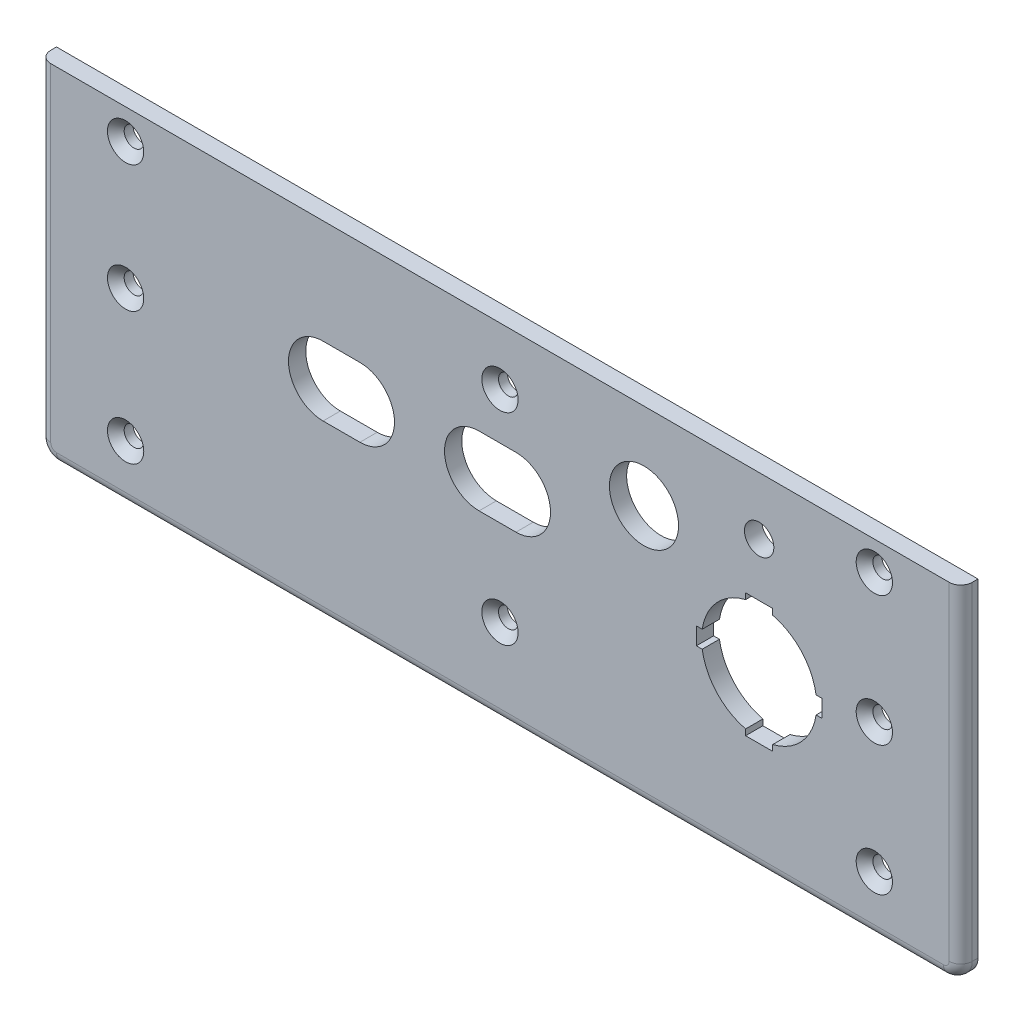
from build123d import *

# Parameters (mm, degrees)
SKETCH11_W                                     = 160
SKETCH11_H                                     = 60
SKETCH11_R                                     = 2.55
SKETCH11_R_2                                   = 6
BOSS_EXTRUDE1_DEPTH                            = 3
FILLET1_R                                      = 2
FILLET3_R                                      = 3
CSK_FOR_M3_FLAT_HEAD_MACHINE_SCREW1_AT_2_COUNT = 2
CSK_FOR_M3_FLAT_HEAD_MACHINE_SCREW1_AT_2_PITCH = 22.042551394
CSK_FOR_M3_FLAT_HEAD_MACHINE_SCREW1_AT_3_COUNT = 2
CSK_FOR_M3_FLAT_HEAD_MACHINE_SCREW1_AT_3_PITCH = 45
CSK_FOR_M3_FLAT_HEAD_MACHINE_SCREW1_AT_4_COUNT = 2
CSK_FOR_M3_FLAT_HEAD_MACHINE_SCREW1_AT_4_PITCH = 137.493516675
CSK_FOR_M3_FLAT_HEAD_MACHINE_SCREW1_AT_5_COUNT = 2
CSK_FOR_M3_FLAT_HEAD_MACHINE_SCREW1_AT_5_PITCH = 131.893933603
CSK_FOR_M3_FLAT_HEAD_MACHINE_SCREW1_AT_6_COUNT = 2
CSK_FOR_M3_FLAT_HEAD_MACHINE_SCREW1_AT_6_PITCH = 130.000201211
CSK_FOR_M3_FLAT_HEAD_MACHINE_SCREW1_AT_7_COUNT = 2
CSK_FOR_M3_FLAT_HEAD_MACHINE_SCREW1_AT_7_PITCH = 65.174880681
CSK_FOR_M3_FLAT_HEAD_MACHINE_SCREW1_AT_8_COUNT = 2
CSK_FOR_M3_FLAT_HEAD_MACHINE_SCREW1_AT_8_PITCH = 76.202062771


with BuildPart() as part:
    # Sketch11 → Boss-Extrude1 (new body)
    with BuildSketch(Plane.XY):
        with Locations((-80, 30)):
            Rectangle(SKETCH11_W, SKETCH11_H)
        with Locations((-35, 50)):
            Circle(SKETCH11_R, mode=Mode.SUBTRACT)
        with Locations((-55, 45)):
            Circle(SKETCH11_R_2, mode=Mode.SUBTRACT)
        with BuildLine():
            Line((-44.886859967, 31.5), (-45.897247359, 31.5))
            Line((-45.897247359, 31.5), (-45.897247359, 28.5))
            Line((-45.897247359, 28.5), (-44.886859967, 28.5))
            ThreePointArc((-44.886859967, 28.5), (-42.370691635, 23.241826814), (-37.35, 20.280046296))
            Line((-37.35, 20.280046296), (-37.35, 19.253954216))
            Line((-37.35, 19.253954216), (-32.65, 19.253954216))
            Line((-32.65, 19.253954216), (-32.65, 20.280046296))
            ThreePointArc((-32.65, 20.280046296), (-27.629308365, 23.241826814), (-25.113140033, 28.5))
            Line((-25.113140033, 28.5), (-24.102752641, 28.5))
            Line((-24.102752641, 28.5), (-24.102752641, 31.5))
            Line((-24.102752641, 31.5), (-25.113140033, 31.5))
            ThreePointArc((-25.113140033, 31.5), (-27.629308365, 36.758173186), (-32.65, 39.719953704))
            Line((-32.65, 39.719953704), (-32.65, 40.746045784))
            Line((-32.65, 40.746045784), (-37.35, 40.746045784))
            Line((-37.35, 40.746045784), (-37.35, 39.719953704))
            ThreePointArc((-37.35, 39.719953704), (-42.370691635, 36.758173186), (-44.886859967, 31.5))
        make_face(mode=Mode.SUBTRACT)
        with BuildLine():
            Line((-83.627304882, 41.930328357), (-77.227304882, 41.930328357))
            ThreePointArc((-77.227304882, 41.930328357), (-71.227304882, 35.930328357), (-77.227304882, 29.930328357))
            Line((-77.227304882, 29.930328357), (-83.627304882, 29.930328357))
            ThreePointArc((-83.627304882, 29.930328357), (-89.627304882, 35.930328357), (-83.627304882, 41.930328357))
        make_face(mode=Mode.SUBTRACT)
        with BuildLine():
            Line((-110.715747539, 41.9), (-104.315747539, 41.9))
            ThreePointArc((-104.315747539, 41.9), (-98.315747539, 35.9), (-104.315747539, 29.9))
            Line((-104.315747539, 29.9), (-110.715747539, 29.9))
            ThreePointArc((-110.715747539, 29.9), (-116.715747539, 35.9), (-110.715747539, 41.9))
        make_face(mode=Mode.SUBTRACT)
    extrude(amount=BOSS_EXTRUDE1_DEPTH)

    # Fillet1
    fillet1_edges = [part.edges().sort_by_distance(p)[0] for p in [
        (-160, 30, 3),
        (-80, 0, 3),
        (0, 30, 3),
    ]]
    fillet(fillet1_edges, radius=FILLET1_R)

    # Fillet3
    # the kernel refuses this fillet: 3 mm, written as the material it takes off along each edge
    with BuildSketch(Plane(origin=(-3, 3, 3), x_dir=(0, -1, 0), z_dir=(-1, 0, 0))) as fillet3_piece_1:
        with BuildLine():
            CenterArc((1, -2), 2, 0, 90)
            Line((3, -2), (3, 0))
            Line((3, 0), (1, 0))
        make_face()
    revolve(axis=Axis((-3, 3, 3), (0, 0, 1)), revolution_arc=90, mode=Mode.SUBTRACT)
    with BuildSketch(Plane(origin=(-157, 3, 3), x_dir=(-1, 0, 0), z_dir=(0, 1, 0))) as fillet3_piece_2:
        with BuildLine():
            CenterArc((1, -2), 2, 0, 90)
            Line((3, -2), (3, 0))
            Line((3, 0), (1, 0))
        make_face()
    revolve(axis=Axis((-157, 3, 3), (0, 0, 1)), revolution_arc=90, mode=Mode.SUBTRACT)
    with BuildSketch(Plane(origin=(0, 0, -7.5), x_dir=(-1, 0, 0), z_dir=(0, 0, 1))) as fillet3_piece_3:
        with BuildLine():
            CenterArc((FILLET3_R, -FILLET3_R), FILLET3_R, 90, 90)
            Line((0, -FILLET3_R), (0, 0))
            Line((0, 0), (FILLET3_R, 0))
        make_face()
    extrude(amount=10.5, mode=Mode.SUBTRACT)
    with BuildSketch(Plane(origin=(-160, 0, -7.5), x_dir=(1, 0, 0), z_dir=(0, 0, 1))) as fillet3_piece_4:
        with BuildLine():
            CenterArc((FILLET3_R, FILLET3_R), FILLET3_R, 180, 90)
            Line((0, FILLET3_R), (0, 0))
            Line((0, 0), (FILLET3_R, 0))
        make_face()
    extrude(amount=10.5, mode=Mode.SUBTRACT)

    # Sketch13 → CSK for M3 Flat Head Machine Screw1 (revolve, cut)
    with BuildSketch(Plane(origin=(-145, 54.771275697, 3), x_dir=(0, -1, 0), z_dir=(1, 0, 0))):
        Polygon((0, 0), (0, 3), (1.7, 3), (1.7, 1.45), (3.15, 0), align=None)
    csk_for_m3_flat_head_machine_screw1 = revolve(axis=Axis((-145, 54.771275697, 9.35), (0, 0, -1)), mode=Mode.SUBTRACT)

    # CSK for M3 Flat Head Machine Screw1 at 2: CSK for M3 Flat Head Machine Screw1 ×2
    with Locations(*[(0, -i * CSK_FOR_M3_FLAT_HEAD_MACHINE_SCREW1_AT_2_PITCH, 0) for i in range(1, CSK_FOR_M3_FLAT_HEAD_MACHINE_SCREW1_AT_2_COUNT)]):
        add(csk_for_m3_flat_head_machine_screw1, mode=Mode.SUBTRACT)

    # CSK for M3 Flat Head Machine Screw1 at 3: CSK for M3 Flat Head Machine Screw1 ×2
    with Locations(*[(0, -i * CSK_FOR_M3_FLAT_HEAD_MACHINE_SCREW1_AT_3_PITCH, 0) for i in range(1, CSK_FOR_M3_FLAT_HEAD_MACHINE_SCREW1_AT_3_COUNT)]):
        add(csk_for_m3_flat_head_machine_screw1, mode=Mode.SUBTRACT)

    # CSK for M3 Flat Head Machine Screw1 at 4: CSK for M3 Flat Head Machine Screw1 ×2
    with Locations(*[Vector(0.9454991271168814, -0.32562463147190707, 0) * (i * CSK_FOR_M3_FLAT_HEAD_MACHINE_SCREW1_AT_4_PITCH) for i in range(1, CSK_FOR_M3_FLAT_HEAD_MACHINE_SCREW1_AT_4_COUNT)]):
        add(csk_for_m3_flat_head_machine_screw1, mode=Mode.SUBTRACT)

    # CSK for M3 Flat Head Machine Screw1 at 5: CSK for M3 Flat Head Machine Screw1 ×2
    with Locations(*[Vector(0.9856404798092461, -0.16885746818367017, 0) * (i * CSK_FOR_M3_FLAT_HEAD_MACHINE_SCREW1_AT_5_PITCH) for i in range(1, CSK_FOR_M3_FLAT_HEAD_MACHINE_SCREW1_AT_5_COUNT)]):
        add(csk_for_m3_flat_head_machine_screw1, mode=Mode.SUBTRACT)

    # CSK for M3 Flat Head Machine Screw1 at 6: CSK for M3 Flat Head Machine Screw1 ×2
    with Locations(*[Vector(0.9999984522282437, 0.001759414992816724, 0) * (i * CSK_FOR_M3_FLAT_HEAD_MACHINE_SCREW1_AT_6_PITCH) for i in range(1, CSK_FOR_M3_FLAT_HEAD_MACHINE_SCREW1_AT_6_COUNT)]):
        add(csk_for_m3_flat_head_machine_screw1, mode=Mode.SUBTRACT)

    # CSK for M3 Flat Head Machine Screw1 at 7: CSK for M3 Flat Head Machine Screw1 ×2
    with Locations(*[Vector(0.997316747201951, -0.07320727935472046, 0) * (i * CSK_FOR_M3_FLAT_HEAD_MACHINE_SCREW1_AT_7_PITCH) for i in range(1, CSK_FOR_M3_FLAT_HEAD_MACHINE_SCREW1_AT_7_COUNT)]):
        add(csk_for_m3_flat_head_machine_screw1, mode=Mode.SUBTRACT)

    # CSK for M3 Flat Head Machine Screw1 at 8: CSK for M3 Flat Head Machine Screw1 ×2
    with Locations(*[Vector(0.8529952817065795, -0.5219186233373103, 0) * (i * CSK_FOR_M3_FLAT_HEAD_MACHINE_SCREW1_AT_8_PITCH) for i in range(1, CSK_FOR_M3_FLAT_HEAD_MACHINE_SCREW1_AT_8_COUNT)]):
        add(csk_for_m3_flat_head_machine_screw1, mode=Mode.SUBTRACT)


solid = part.part
